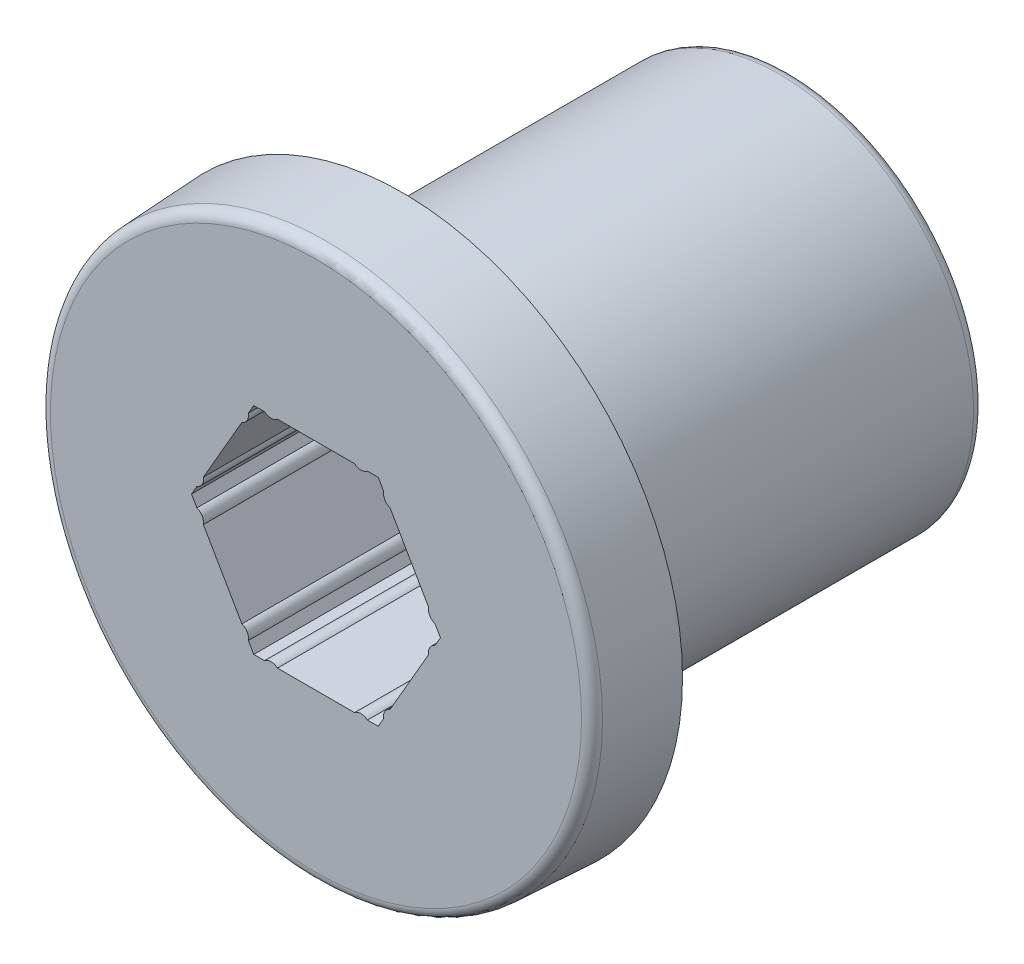
from build123d import *

# Parameters (mm, degrees)
SKETCH2_R           = 4.5
BOSS_EXTRUDE1_DEPTH = 9
CUT_EXTRUDE1_DEPTH  = 15.335271187
FILLET1_R           = 0.25


with BuildPart() as part:
    # Sketch1 → Revolve1 (revolve)
    with BuildSketch(Plane(origin=(0, 0, 0), x_dir=(1, 0, 0), z_dir=(0, 1, 0))):
        Polygon((6.5, 0), (0, 0), (0, -2), (6.395184442, -2), align=None)
    revolve(axis=Axis((0, 0, 0), (0, 0, 1)))

    # Sketch2 → Boss-Extrude1 (add)
    with BuildSketch(Plane(origin=(0, 0, 0), x_dir=(-1, 0, 0), z_dir=(0, 0, -1))):
        Circle(SKETCH2_R)
    extrude(amount=BOSS_EXTRUDE1_DEPTH)

    # Sketch3 → Cut-Extrude1 (cut, through all)
    with BuildSketch(Plane(origin=(0, 0, -9), x_dir=(-1, 0, 0), z_dir=(0, 0, -1))):
        with BuildLine():
            Line((1.193375673, -2.5), (1.443375673, -2.5))
            Line((1.443375673, -2.5), (1.568375673, -2.283493649))
            ThreePointArc((1.568375673, -2.283493649), (1.595744276, -2.126089838), (1.718375673, -2.023686028))
            Line((1.718375673, -2.023686028), (2.611751346, -0.476313972))
            ThreePointArc((2.611751346, -0.476313972), (2.639119949, -0.318910162), (2.761751346, -0.216506351))
            Line((2.761751346, -0.216506351), (2.886751346, 0))
            Line((2.886751346, 0), (2.761751346, 0.216506351))
            ThreePointArc((2.761751346, 0.216506351), (2.639119949, 0.318910162), (2.611751346, 0.476313972))
            Line((2.611751346, 0.476313972), (1.718375673, 2.023686028))
            ThreePointArc((1.718375673, 2.023686028), (1.595744276, 2.126089838), (1.568375673, 2.283493649))
            Line((1.568375673, 2.283493649), (1.443375673, 2.5))
            Line((1.443375673, 2.5), (1.193375673, 2.5))
            ThreePointArc((1.193375673, 2.5), (1.043375673, 2.445), (0.893375673, 2.5))
            Line((0.893375673, 2.5), (-0.893375673, 2.5))
            ThreePointArc((-0.893375673, 2.5), (-1.043375673, 2.445), (-1.193375673, 2.5))
            Line((-1.193375673, 2.5), (-1.443375673, 2.5))
            Line((-1.443375673, 2.5), (-1.568375673, 2.283493649))
            ThreePointArc((-1.568375673, 2.283493649), (-1.595744276, 2.126089838), (-1.718375673, 2.023686028))
            Line((-1.718375673, 2.023686028), (-2.611751346, 0.476313972))
            ThreePointArc((-2.611751346, 0.476313972), (-2.639119949, 0.318910162), (-2.761751346, 0.216506351))
            Line((-2.761751346, 0.216506351), (-2.886751346, 0))
            Line((-2.886751346, 0), (-2.761751346, -0.216506351))
            ThreePointArc((-2.761751346, -0.216506351), (-2.639119949, -0.318910162), (-2.611751346, -0.476313972))
            Line((-2.611751346, -0.476313972), (-1.718375673, -2.023686028))
            ThreePointArc((-1.718375673, -2.023686028), (-1.595744276, -2.126089838), (-1.568375673, -2.283493649))
            Line((-1.568375673, -2.283493649), (-1.443375673, -2.5))
            Line((-1.443375673, -2.5), (-1.193375673, -2.5))
            ThreePointArc((-1.193375673, -2.5), (-1.043375673, -2.445), (-0.893375673, -2.5))
            Line((-0.893375673, -2.5), (0.893375673, -2.5))
            ThreePointArc((0.893375673, -2.5), (1.043375673, -2.445), (1.193375673, -2.5))
        make_face()
    extrude(amount=-CUT_EXTRUDE1_DEPTH, mode=Mode.SUBTRACT)

    # Fillet1
    fillet1_edges = [part.edges().sort_by_distance(p)[0] for p in [
        (4.5, 0, -9),
        (-6.395184442, 0, 2),
    ]]
    fillet(fillet1_edges, radius=FILLET1_R)


solid = part.part
